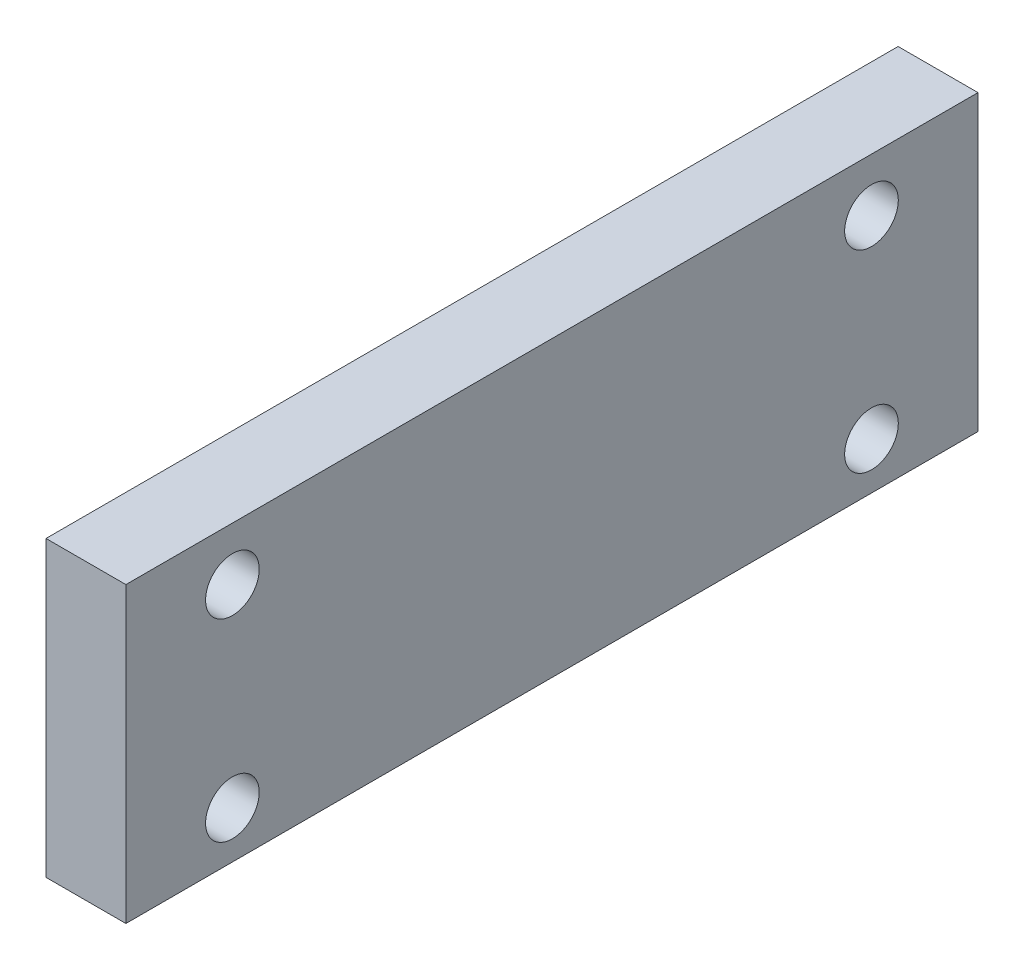
from build123d import *

# Parameters (mm, degrees)
SKETCH1_W           = 101.6
SKETCH1_H           = 35
BOSS_EXTRUDE1_DEPTH = 4.7625
SKETCH2_R           = 3.2
CUT_EXTRUDE1_DEPTH  = 55.5675327


with BuildPart() as part:
    # Sketch1 → Boss-Extrude1 (new, symmetric)
    with BuildSketch(Plane(origin=(0, 0, 0), x_dir=(0, 0, -1), z_dir=(1, 0, 0))):
        Rectangle(SKETCH1_W, SKETCH1_H)
    extrude(amount=BOSS_EXTRUDE1_DEPTH, both=True)

    # Sketch2 → Cut-Extrude1 (cut, through all)
    with BuildSketch(Plane(origin=(4.7625, 0, 0), x_dir=(0, 0, -1), z_dir=(1, 0, 0))):
        with Locations((-38.1, 11.15)):
            Circle(SKETCH2_R)
        with Locations((38.1, 11.15)):
            Circle(SKETCH2_R)
        with Locations((-38.1, -11.9)):
            Circle(SKETCH2_R)
        with Locations((38.1, -11.9)):
            Circle(SKETCH2_R)
    extrude(amount=-CUT_EXTRUDE1_DEPTH, mode=Mode.SUBTRACT)


solid = part.part
